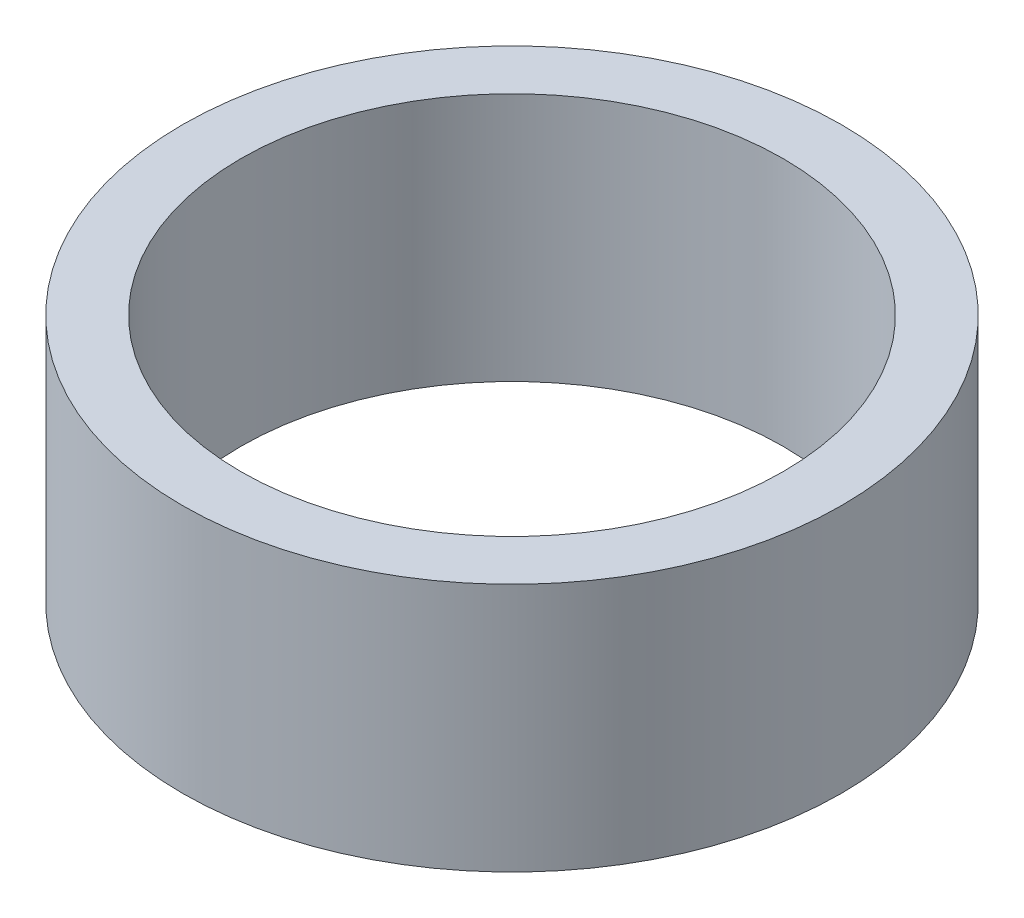
from build123d import *

# Parameters (mm, degrees)
SKETCH1_R           = 3.96875
SKETCH1_R_2         = 3.2639
BOSS_EXTRUDE1_DEPTH = 3


with BuildPart() as part:
    # Sketch1 → Boss-Extrude1 (new body)
    with BuildSketch(Plane(origin=(0, 0, 0), x_dir=(1, 0, 0), z_dir=(0, 1, 0))):
        Circle(SKETCH1_R)
        Circle(SKETCH1_R_2, mode=Mode.SUBTRACT)
    extrude(amount=BOSS_EXTRUDE1_DEPTH)


solid = part.part
